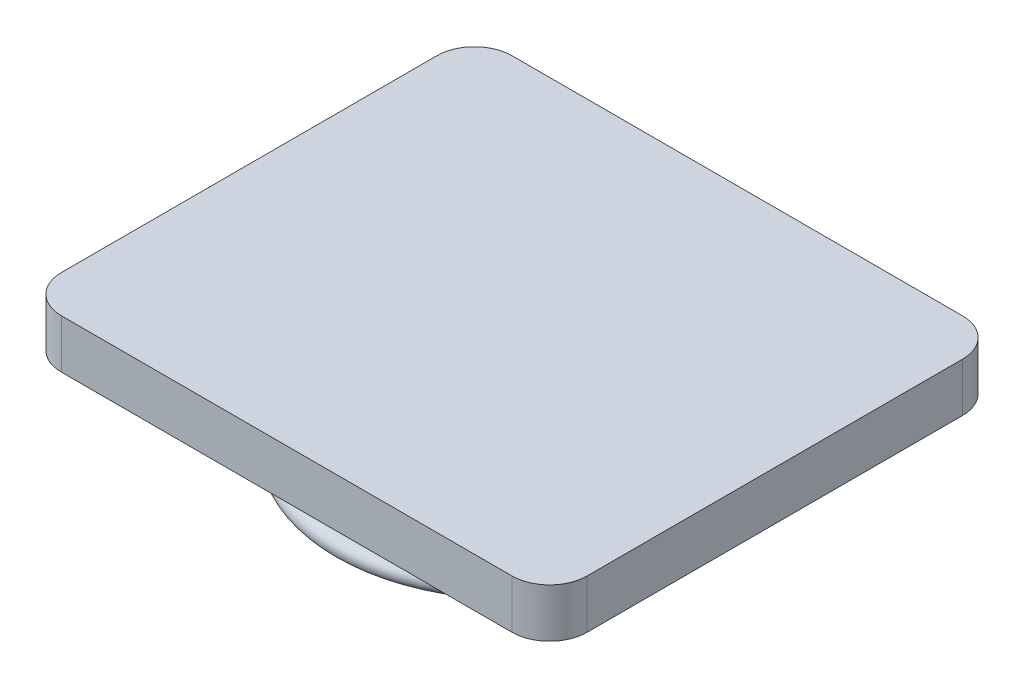
from build123d import *

# Parameters (mm, degrees)
ESBO_O1_R                = 22.5
RESSALTO_EXTRUS_O1_DEPTH = 10
ESBO_O3_W                = 70
ESBO_O3_H                = 60
RESSALTO_EXTRUS_O2_DEPTH = 6.5
ESBO_O5_R                = 5
RESSALTO_EXTRUS_O3_DEPTH = 13
CHANFRO1_SIZE            = 0.5
FILETE1_R                = 5


# Read off the part's stored shape, not the designer's step: Varredura1
with BuildPart() as part:
    # Esboço1 → Ressalto-extrusão1 (new body)
    with BuildSketch(Plane(origin=(0, 0, 0), x_dir=(1, 0, 0), z_dir=(0, 1, 0))):
        with Locations(Location((0, 0, 0), (0, 0, 270))):
            Circle(ESBO_O1_R)
    extrude(amount=RESSALTO_EXTRUS_O1_DEPTH)

    # Esboço3 → Ressalto-extrusão2 (add)
    with BuildSketch(Plane(origin=(0, 10, 0), x_dir=(1, 0, 0), z_dir=(0, 1, 0))):
        Rectangle(ESBO_O3_W, ESBO_O3_H)
    extrude(amount=RESSALTO_EXTRUS_O2_DEPTH)

    # Varredura1 outline → Varredura1 (revolve)
    with BuildSketch(Plane.XY):
        with BuildLine():
            Line((22.5, 2.5), (22.5, 0))
            ThreePointArc((22.5, 0), (23.75, 1.25), (22.5, 2.5))
        make_face()
    revolve(axis=Axis((0, 0, 0), (0, 1, 0)))

    # Esboço5 → Ressalto-extrusão3 (add)
    with BuildSketch(Plane.XZ):
        with Locations(Location((0, 0, 0), (0, 0, 90))):
            Circle(ESBO_O5_R)
    extrude(amount=RESSALTO_EXTRUS_O3_DEPTH)

    # Chanfro1
    chanfro1_edges = [part.edges().sort_by_distance(p)[0] for p in [
        (0, -13, -5),
    ]]
    chamfer(chanfro1_edges, length=CHANFRO1_SIZE)

    # Filete1
    filete1_edges = [part.edges().sort_by_distance(p)[0] for p in [
        (35, 13.25, 30),
        (35, 13.25, -30),
        (-35, 13.25, -30),
        (-35, 13.25, 30),
    ]]
    fillet(filete1_edges, radius=FILETE1_R)


solid = part.part
